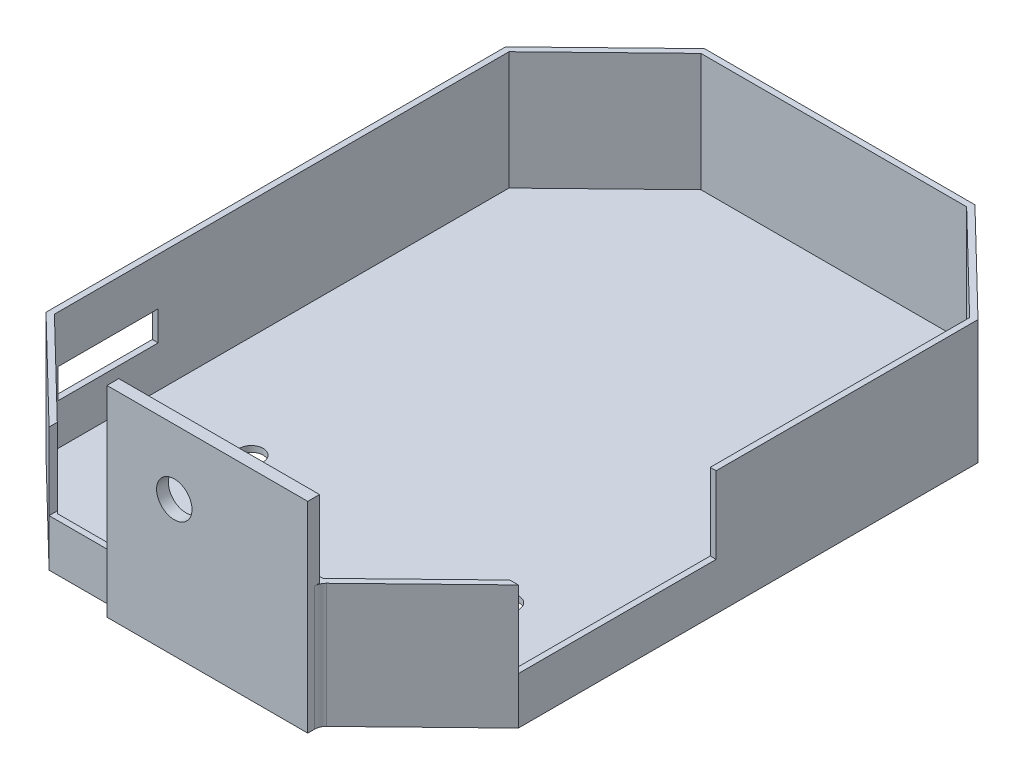
from build123d import *

# Parameters (mm, degrees)
SALIENTE_EXTRUIR1_DEPTH = 20
VACIADO1_T              = 1
CORTAR_EXTRUIR1_REACH   = 139.703
CROQUIS2_W              = 38
CROQUIS2_H              = 13
CORTAR_EXTRUIR2_REACH   = 139.477
CROQUIS3_W              = 33.5
CROQUIS3_H              = 13
CORTAR_EXTRUIR3_REACH   = 139.477
CROQUIS4_W              = 17
CROQUIS4_H              = 5
CROQUIS6_W              = 0.987179487
CROQUIS6_H              = 5.5
CORTAR_EXTRUIR5_DEPTH   = 0.35
CROQUIS7_W              = 34
CROQUIS7_H              = 34
SALIENTE_EXTRUIR2_DEPTH = 2
REDONDEO1_R             = 2
CROQUIS8_R              = 3
CORTAR_EXTRUIR6_DEPTH   = 2
CROQUIS9_R              = 2
CORTAR_EXTRUIR7_DEPTH   = 2


with BuildPart() as part:
    # Croquis1 → Saliente-Extruir1 (new body)
    with BuildSketch(Plane(origin=(0, 0, 0), x_dir=(1, 0, 0), z_dir=(0, 1, 0))):
        Polygon((0, 16), (16.5, 0), (61.5, 0), (78, 16), (78, 93), (61.5, 109), (16.5, 109), (0, 93), align=None)
    extrude(amount=SALIENTE_EXTRUIR1_DEPTH)

    # Vaciado1
    vaciado1_openings = [part.faces().sort_by_distance(p)[0] for p in [
        (39, 20, -54.5),
    ]]
    offset(amount=VACIADO1_T, openings=vaciado1_openings, kind=Kind.INTERSECTION)

    # Croquis2 → Cortar-Extruir1 (cut, up to next)
    with BuildSketch(Plane.XY.offset(1), mode=Mode.PRIVATE) as cortar_extruir1_sk1:
        with Locations((35.094769383, 13.5)):
            Rectangle(CROQUIS2_W, CROQUIS2_H)
    cortar_extruir1_tool1 = extrude(cortar_extruir1_sk1.sketch, amount=-CORTAR_EXTRUIR1_REACH, mode=Mode.PRIVATE) & part.part
    add(cortar_extruir1_tool1.solids().sort_by_distance((35.094769, 13.5, 1))[0], mode=Mode.SUBTRACT)

    # Croquis3 → Cortar-Extruir2 (cut, up to next)
    with BuildSketch(Plane(origin=(79, 0, 0), x_dir=(0, 0, -1), z_dir=(1, 0, 0)), mode=Mode.PRIVATE) as cortar_extruir2_sk1:
        with Locations((32.326746069, 13.5)):
            Rectangle(CROQUIS3_W, CROQUIS3_H)
    cortar_extruir2_tool1 = extrude(cortar_extruir2_sk1.sketch, amount=-CORTAR_EXTRUIR2_REACH, mode=Mode.PRIVATE) & part.part
    add(cortar_extruir2_tool1.solids().sort_by_distance((79, 13.5, -32.326746))[0], mode=Mode.SUBTRACT)

    # Croquis4 → Cortar-Extruir3 (cut, up to next)
    with BuildSketch(Plane.ZY.offset(1), mode=Mode.PRIVATE) as cortar_extruir3_sk1:
        with Locations((-25.076746069, 9.5)):
            Rectangle(CROQUIS4_W, CROQUIS4_H)
    cortar_extruir3_tool1 = extrude(cortar_extruir3_sk1.sketch, amount=-CORTAR_EXTRUIR3_REACH, mode=Mode.PRIVATE) & part.part
    add(cortar_extruir3_tool1.solids().sort_by_distance((-1, 9.5, -25.076746))[0], mode=Mode.SUBTRACT)

    # Croquis6 → Cortar-Extruir5 (cut)
    # profile 1 of 16: a face of its own
    with BuildSketch(Plane.XZ.offset(1)):
        with BuildLine():
            Line((74.78525641, -70), (74.78525641, -75.5))
            Line((74.78525641, -75.5), (73.903846154, -75.5))
            add(Edge.make_bspline(
                [(73.903846154, -75.5), (73.842141815, -75.500008424), (73.722745088, -75.500024723), (73.550488554, -75.493957045), (73.39109479, -75.486212134), (73.244369275, -75.47725638), (73.110366331, -75.462393242), (72.988993666, -75.446397699), (72.880700808, -75.427235506), (72.813750035, -75.410035311), (72.782251603, -75.401943109)],
                knots=[0, 0, 0, 0, 1.311970222, 2.538637508, 3.664491357, 4.705491327, 5.663608299, 6.530571107, 7.308675535, 8, 8, 8, 8], degree=3))
            add(Edge.make_bspline(
                [(72.782251603, -75.401943109), (72.740891243, -75.390529314), (72.659728939, -75.368131784), (72.543472488, -75.322907192), (72.433210644, -75.272606269), (72.328967519, -75.215334017), (72.231975971, -75.150022308), (72.140906451, -75.077916845), (72.056182581, -74.998993257), (71.979154829, -74.912783916), (71.909629264, -74.821559618), (71.848973098, -74.725277844), (71.796579646, -74.625464579), (71.756348866, -74.520397206), (71.722565206, -74.412819622), (71.699963218, -74.300546707), (71.684797783, -74.184545617), (71.683401221, -74.105585822), (71.682692308, -74.065504808)],
                knots=[0, 0, 0, 0, 1.099879008, 2.158315707, 3.195196496, 4.207130292, 5.205157476, 6.190838564, 7.183874245, 8.171129509, 9.152705923, 10.122275948, 11.08707516, 12.038677937, 13.004120747, 13.975884785, 14.972532894, 16, 16, 16, 16], degree=3))
            add(Edge.make_bspline(
                [(71.682692308, -74.065504808), (71.68441213, -74.013983414), (71.687799421, -73.912509041), (71.713793986, -73.764151677), (71.755685753, -73.623158234), (71.814882518, -73.48830796), (71.894350983, -73.359805067), (71.993450161, -73.23521183), (72.114644996, -73.116229433), (72.206065956, -73.043348232), (72.253405449, -73.005608974)],
                knots=[0, 0, 0, 0, 0.986462413, 1.942894939, 2.875435142, 3.798266677, 4.755009598, 5.761362919, 6.840791609, 8, 8, 8, 8], degree=3))
            add(Edge.make_bspline(
                [(72.253405449, -73.005608974), (72.214623713, -72.985817497), (72.138583459, -72.947011886), (72.030695506, -72.883153894), (71.930551768, -72.815508911), (71.83884727, -72.744181247), (71.753410647, -72.670586892), (71.679546635, -72.590218069), (71.609957713, -72.509278167), (71.550380915, -72.422551037), (71.498870875, -72.331889758), (71.453174551, -72.238319378), (71.415849512, -72.139979216), (71.383719327, -72.038275881), (71.359371506, -71.932158614), (71.343624489, -71.822289019), (71.331543744, -71.708731513), (71.330605338, -71.631377763), (71.330128205, -71.592047276)],
                knots=[0, 0, 0, 0, 1.164301211, 2.282872552, 3.350830854, 4.394111106, 5.389302619, 6.362088852, 7.310365691, 8.24222091, 9.170601078, 10.097577168, 11.024240953, 11.981127157, 12.948542686, 13.932080445, 14.948567018, 16, 16, 16, 16], degree=3))
            add(Edge.make_bspline(
                [(71.330128205, -71.592047276), (71.333070133, -71.51688981), (71.33887894, -71.368492109), (71.385882712, -71.151445708), (71.460907767, -70.944617018), (71.566101896, -70.751321646), (71.694277297, -70.574989966), (71.84104233, -70.419253617), (72.006541102, -70.28883387), (72.158208714, -70.199908838), (72.290088574, -70.140615463), (72.399771855, -70.104284513), (72.517497405, -70.070609821), (72.644583555, -70.044520678), (72.780396484, -70.025081432), (72.924874121, -70.010918822), (73.078514754, -70.001986756), (73.184015171, -70.000675641), (73.23838141, -70)],
                knots=[0, 0, 0, 0, 1.284225818, 2.535691644, 3.779474941, 5.035581115, 6.285533147, 7.498311102, 8.683187976, 9.876672238, 10.49522506, 11.152635743, 11.850557634, 12.588370465, 13.369094102, 14.195874568, 15.07030211, 16, 16, 16, 16], degree=3))
            Line((73.23838141, -70), (74.78525641, -70))
        make_face()
        with BuildLine():
            Line((73.798076923, -74.512820513), (73.798076923, -73.314102564))
            Line((73.798076923, -73.314102564), (73.535857372, -73.314102564))
            add(Edge.make_bspline(
                [(73.535857372, -73.314102564), (73.500218937, -73.314411924), (73.431421094, -73.315009126), (73.332057065, -73.322755057), (73.239638734, -73.335872663), (73.154288371, -73.354563169), (73.0755074, -73.37721138), (73.004228851, -73.406017738), (72.940221267, -73.44038823), (72.864804624, -73.490336845), (72.787120964, -73.566827002), (72.717559379, -73.674798385), (72.676791346, -73.799771364), (72.672228158, -73.887824113), (72.669871795, -73.933293269)],
                knots=[0, 0, 0, 0, 1.06517797, 2.056261606, 2.976983468, 3.853439442, 4.666321732, 5.424739265, 6.146762548, 6.834937974, 8.123729748, 9.372478121, 10.64318598, 12, 12, 12, 12], degree=3))
            add(Edge.make_bspline(
                [(72.669871795, -73.933293269), (72.67175662, -73.975884954), (72.675400853, -74.058234265), (72.716477367, -74.173939086), (72.780466542, -74.275944088), (72.854874673, -74.346765876), (72.925827852, -74.394381791), (72.986904113, -74.426131705), (73.054024476, -74.454323026), (73.128835512, -74.474008899), (73.209095495, -74.492486137), (73.296533117, -74.503721294), (73.390263562, -74.512014445), (73.45503998, -74.51254606), (73.488481571, -74.512820513)],
                knots=[0, 0, 0, 0, 1.347812291, 2.605940898, 3.848830773, 5.144272192, 5.83350599, 6.558918059, 7.32804622, 8.140548749, 9.012446266, 9.943019774, 10.938059685, 12, 12, 12, 12], degree=3))
            Line((73.488481571, -74.512820513), (73.798076923, -74.512820513))
        make_face(mode=Mode.SUBTRACT)
        with BuildLine():
            Line((73.798076923, -72.397435897), (73.798076923, -70.987179487))
            Line((73.798076923, -70.987179487), (73.513822115, -70.987179487))
            add(Edge.make_bspline(
                [(73.513822115, -70.987179487), (73.45762596, -70.987506323), (73.349581839, -70.988134705), (73.194786859, -70.995516786), (73.054115791, -71.009208593), (72.927535532, -71.025194438), (72.81608217, -71.050470702), (72.717720189, -71.076751508), (72.634154045, -71.110556012), (72.563957619, -71.149757128), (72.505249686, -71.194100614), (72.454412666, -71.242091663), (72.412010791, -71.295716693), (72.377910243, -71.35378946), (72.349264429, -71.415774104), (72.331716631, -71.483728115), (72.318418867, -71.555538215), (72.317683785, -71.605200203), (72.317307692, -71.630608974)],
                knots=[0, 0, 0, 0, 1.753677247, 3.371663338, 4.833688836, 6.164395063, 7.349095089, 8.3975697, 9.338276771, 10.154261968, 10.899224605, 11.628775934, 12.330426574, 13.024264642, 13.727131073, 14.452891561, 15.208446408, 16, 16, 16, 16], degree=3))
            add(Edge.make_bspline(
                [(72.317307692, -71.630608974), (72.318133035, -71.659665919), (72.319740582, -71.716261029), (72.332911219, -71.798966158), (72.356740143, -71.876232588), (72.387222394, -71.95006412), (72.428375752, -72.018447164), (72.478646545, -72.081836979), (72.537587911, -72.140420414), (72.605386013, -72.195085587), (72.68410414, -72.244189075), (72.775553023, -72.283903774), (72.877370061, -72.319731675), (72.991548522, -72.34742703), (73.11719431, -72.371181716), (73.25539653, -72.385306466), (73.40495213, -72.395832446), (73.508658725, -72.396889269), (73.562299679, -72.397435897)],
                knots=[0, 0, 0, 0, 0.844862234, 1.645564352, 2.426138401, 3.19188377, 3.963047654, 4.738710309, 5.53926994, 6.37496817, 7.267116735, 8.227971149, 9.268346748, 10.402975021, 11.641070045, 12.984514716, 14.440277492, 16, 16, 16, 16], degree=3))
            Line((73.562299679, -72.397435897), (73.798076923, -72.397435897))
        make_face(mode=Mode.SUBTRACT)
    # profile 2 of 16: a face of its own
    with BuildSketch(Plane.XZ.offset(1)):
        with Locations((69.990384616, -72.75)):
            Rectangle(CROQUIS6_W, CROQUIS6_H)
    # profile 3 of 16: a face of its own
    with BuildSketch(Plane.XZ.offset(1)):
        with BuildLine():
            add(Edge.make_bspline(
                [(65.642828526, -75.641025641), (65.547203808, -75.638550753), (65.358418956, -75.633664763), (65.080792829, -75.592905516), (64.813216637, -75.526570603), (64.555652024, -75.433977747), (64.308977411, -75.314061695), (64.072286454, -75.168460287), (63.846227779, -74.995938037), (63.633437004, -74.798956845), (63.438313072, -74.583564073), (63.26679692, -74.353924349), (63.121201447, -74.112408606), (63.00302125, -73.858969786), (62.910731039, -73.593956016), (62.846590428, -73.31726672), (62.805234083, -73.029256213), (62.800488678, -72.833143733), (62.798076923, -72.733473558)],
                knots=[0, 0, 0, 0, 1.014151002, 2.002163778, 2.969868608, 3.93493411, 4.9003771, 5.874719092, 6.87846472, 7.912488755, 8.947011879, 9.957751389, 10.948740761, 11.933621513, 12.919426746, 13.920294397, 14.943031967, 16, 16, 16, 16], degree=3))
            add(Edge.make_bspline(
                [(62.798076923, -72.733473558), (62.800646149, -72.634926624), (62.805708892, -72.44073673), (62.84489708, -72.155377652), (62.910152474, -71.881662207), (63.00066344, -71.619496819), (63.116777232, -71.368877191), (63.260149181, -71.130616554), (63.429837327, -70.904225356), (63.622375423, -70.691090557), (63.833035456, -70.496369172), (64.057489913, -70.325427715), (64.293653496, -70.18165017), (64.540017318, -70.062311722), (64.798905543, -69.972632275), (65.067447897, -69.905506942), (65.347890814, -69.866691379), (65.538411519, -69.861572569), (65.635116186, -69.858974359)],
                knots=[0, 0, 0, 0, 1.051517626, 2.07204922, 3.067438659, 4.05042616, 5.027204762, 6.009981242, 7.012629434, 8.042243656, 9.071350414, 10.070091277, 11.048190212, 12.017682766, 12.985867053, 13.966945899, 14.968060614, 16, 16, 16, 16], degree=3))
            add(Edge.make_bspline(
                [(65.635116186, -69.858974359), (65.7362655, -69.861277758), (65.935010077, -69.865803622), (66.225945855, -69.908479456), (66.504290203, -69.973544448), (66.769280451, -70.067742901), (67.020710598, -70.190140676), (67.259708202, -70.337926649), (67.484475789, -70.513955508), (67.694264141, -70.712917925), (67.884310757, -70.930682907), (68.05206996, -71.160717647), (68.193577116, -71.40128253), (68.308839495, -71.652485548), (68.399707629, -71.912766737), (68.463804796, -72.183710965), (68.501668517, -72.464668495), (68.506942714, -72.655500462), (68.509615385, -72.752203526)],
                knots=[0, 0, 0, 0, 1.067953136, 2.098381936, 3.099641766, 4.083805132, 5.062469929, 6.048665414, 7.046702845, 8.073106546, 9.098695993, 10.09591865, 11.076726721, 12.041940862, 13.011263376, 13.984305721, 14.978557872, 16, 16, 16, 16], degree=3))
            add(Edge.make_bspline(
                [(68.509615385, -72.752203526), (68.508764974, -72.817257463), (68.507074919, -72.946541607), (68.487163443, -73.138183839), (68.457632288, -73.325810789), (68.417204846, -73.509775282), (68.362735639, -73.68960323), (68.296532742, -73.86574824), (68.2193855, -74.038209337), (68.130421315, -74.205426855), (68.029785073, -74.365400126), (67.922332719, -74.519526367), (67.803948601, -74.663759459), (67.67707622, -74.799666128), (67.541218627, -74.926625114), (67.396139211, -75.045069926), (67.242066324, -75.154698465), (67.080666471, -75.25641664), (66.912491763, -75.345505958), (66.741543391, -75.426258902), (66.566180273, -75.491733366), (66.387675663, -75.54596138), (66.206439958, -75.589481563), (66.021073861, -75.618418774), (65.83314182, -75.638487554), (65.706416841, -75.640177604), (65.642828526, -75.641025641)],
                knots=[0, 0, 0, 0, 1.034641744, 2.056182551, 3.061960284, 4.05571729, 5.050247014, 6.048716841, 7.047801973, 8.054190544, 9.059424999, 10.053182006, 11.041513076, 12.025412457, 13.009311837, 13.997642908, 15.002928308, 16.016213968, 17.030509951, 18.02913364, 19.022134519, 20.005478534, 20.996155877, 21.984625117, 22.988721131, 24, 24, 24, 24], degree=3))
        make_face()
        with BuildLine():
            add(Edge.make_bspline(
                [(65.658253205, -74.653846154), (65.722608303, -74.65211936), (65.849619515, -74.648711359), (66.035921884, -74.622747069), (66.214778533, -74.581278984), (66.38519895, -74.521213547), (66.5479182, -74.44476343), (66.703238017, -74.35220501), (66.848957182, -74.240321312), (66.987212981, -74.115252807), (67.111683162, -73.975322087), (67.223598714, -73.826996311), (67.31408698, -73.666706509), (67.391893971, -73.499732195), (67.449366468, -73.321850764), (67.493125782, -73.13594922), (67.516959995, -72.940119148), (67.520584592, -72.806983153), (67.522435897, -72.738982372)],
                knots=[0, 0, 0, 0, 1.033668485, 2.040047952, 3.016132939, 3.979056467, 4.937231767, 5.900589077, 6.877725736, 7.88429546, 8.891280164, 9.882584218, 10.863295226, 11.842887319, 12.837417301, 13.860812229, 14.907384602, 16, 16, 16, 16], degree=3))
            add(Edge.make_bspline(
                [(67.522435897, -72.738982372), (67.520185545, -72.663601224), (67.515775227, -72.515866665), (67.485195138, -72.300239941), (67.431612863, -72.096836189), (67.358413018, -71.904974956), (67.261109544, -71.726673771), (67.144732393, -71.559771033), (67.006367735, -71.405302285), (66.899960047, -71.315041856), (66.845953526, -71.269230769)],
                knots=[0, 0, 0, 0, 1.078343132, 2.113373867, 3.107373148, 4.082093053, 5.043582658, 6.005574554, 6.987742499, 8, 8, 8, 8], degree=3))
            add(Edge.make_bspline(
                [(66.845953526, -71.269230769), (66.801700088, -71.235392664), (66.71419025, -71.168478833), (66.574505496, -71.082715031), (66.430657705, -71.009206897), (66.281561365, -70.949813195), (66.127531359, -70.903095107), (65.96858881, -70.870379198), (65.804958925, -70.849847136), (65.694304729, -70.847393165), (65.638421474, -70.846153846)],
                knots=[0, 0, 0, 0, 1.023928204, 2.024787132, 3.009472467, 3.9914905, 4.972207045, 5.96565515, 6.972602802, 8, 8, 8, 8], degree=3))
            add(Edge.make_bspline(
                [(65.638421474, -70.846153846), (65.575174188, -70.847897752), (65.450733163, -70.851328942), (65.267881431, -70.876938315), (65.092785175, -70.920468287), (64.923821436, -70.979580412), (64.763252766, -71.058800898), (64.608575217, -71.15286915), (64.461632279, -71.264718954), (64.32421528, -71.392939291), (64.198279946, -71.53287661), (64.086862223, -71.682004666), (63.99458998, -71.84032926), (63.917623185, -72.00573552), (63.857657481, -72.179540425), (63.816619654, -72.361757084), (63.790245429, -72.551650336), (63.786940212, -72.680866915), (63.78525641, -72.746694712)],
                knots=[0, 0, 0, 0, 1.026350473, 2.019376834, 2.989435443, 3.95094063, 4.91865229, 5.889827372, 6.885283771, 7.910196595, 8.935871797, 9.9372888, 10.925850568, 11.904605667, 12.894245083, 13.903507864, 14.931967858, 16, 16, 16, 16], degree=3))
            add(Edge.make_bspline(
                [(63.78525641, -72.746694712), (63.786991949, -72.812146681), (63.790408093, -72.940978902), (63.81616098, -73.130345367), (63.858974279, -73.311560806), (63.919483154, -73.485092345), (63.994864622, -73.651851013), (64.089556294, -73.810389487), (64.201505682, -73.960570603), (64.328666257, -74.101501515), (64.467049961, -74.231016678), (64.615624696, -74.343410084), (64.770226066, -74.441076955), (64.934403241, -74.5175851), (65.104796811, -74.578539013), (65.282446655, -74.62342634), (65.468025598, -74.648528965), (65.594278792, -74.652057959), (65.658253205, -74.653846154)],
                knots=[0, 0, 0, 0, 1.055040155, 2.076685641, 3.074845078, 4.052329834, 5.035358467, 6.020382375, 7.023447318, 8.050688466, 9.077178457, 10.074336316, 11.0503314, 12.019748348, 12.988025369, 13.964577102, 14.968620271, 16, 16, 16, 16], degree=3))
        make_face(mode=Mode.SUBTRACT)
    # profile 4 of 16: a face of its own
    with BuildSketch(Plane.XZ.offset(1)):
        with BuildLine():
            Line((56.875, -74.545873397), (57.598858173, -73.853966346))
            add(Edge.make_bspline(
                [(57.598858173, -73.853966346), (57.660190249, -73.917550259), (57.780186026, -74.041951742), (57.974463806, -74.204806827), (58.174189337, -74.34321321), (58.379921646, -74.456024252), (58.59154255, -74.545552001), (58.809420229, -74.60800652), (59.033028395, -74.647331583), (59.184132782, -74.651662563), (59.260316506, -74.653846154)],
                knots=[0, 0, 0, 0, 1.115370381, 2.182214363, 3.196266025, 4.180416361, 5.141116029, 6.092551847, 7.038303877, 8, 8, 8, 8], degree=3))
            add(Edge.make_bspline(
                [(59.260316506, -74.653846154), (59.323930719, -74.652087218), (59.449466358, -74.648616151), (59.633768156, -74.623108488), (59.810129193, -74.579895211), (59.97868939, -74.519829069), (60.140282127, -74.444185656), (60.293402689, -74.34910734), (60.438873961, -74.237767473), (60.574996232, -74.110360889), (60.697885198, -73.970129804), (60.808609902, -73.822441333), (60.900322405, -73.664683226), (60.975187218, -73.499156078), (61.034182412, -73.325800118), (61.076053668, -73.144624022), (61.100313902, -72.955218728), (61.103930944, -72.826457747), (61.105769231, -72.761017628)],
                knots=[0, 0, 0, 0, 1.035268443, 2.04298821, 3.02163646, 3.985902049, 4.951223231, 5.920091634, 6.913651787, 7.92868536, 8.949353712, 9.945284791, 10.92850487, 11.913014323, 12.897904816, 13.904240668, 14.934873455, 16, 16, 16, 16], degree=3))
            add(Edge.make_bspline(
                [(61.105769231, -72.761017628), (61.105231895, -72.715088522), (61.104172794, -72.62456131), (61.092871566, -72.4909905), (61.074102959, -72.361114995), (61.047778504, -72.235319599), (61.014638256, -72.11306166), (60.974077747, -71.995137506), (60.925036195, -71.881395841), (60.870150552, -71.771240853), (60.80888645, -71.665605934), (60.740212202, -71.565891913), (60.664897353, -71.472873608), (60.585955519, -71.383314308), (60.498158557, -71.302455157), (60.405437446, -71.225839892), (60.306461816, -71.155366547), (60.201351863, -71.092015855), (60.093245, -71.032974109), (59.979925949, -70.984079939), (59.864561289, -70.940126991), (59.745127137, -70.907061149), (59.623727317, -70.878300857), (59.498672058, -70.860736052), (59.371148182, -70.847389123), (59.284959651, -70.846567378), (59.241586538, -70.846153846)],
                knots=[0, 0, 0, 0, 1.103833241, 2.175677997, 3.219414644, 4.256521947, 5.263082927, 6.262573145, 7.25136242, 8.238376666, 9.219530388, 10.184343756, 11.145312504, 12.095474572, 13.051075647, 14.010745898, 14.985684176, 15.968306307, 16.959653902, 17.943861036, 18.93268972, 19.924626761, 20.920484516, 21.929288403, 22.957944781, 24, 24, 24, 24], degree=3))
            add(Edge.make_bspline(
                [(59.241586538, -70.846153846), (59.168017001, -70.848277005), (59.023471992, -70.852448461), (58.811362666, -70.885211063), (58.608661717, -70.938861149), (58.447022263, -71.003391684), (58.320547072, -71.066124583), (58.224312824, -71.123320088), (58.125219448, -71.188106476), (58.023945404, -71.262278434), (57.919942488, -71.344953278), (57.814997382, -71.437859017), (57.706437892, -71.537960227), (57.63532108, -71.609403411), (57.598858173, -71.646033654)],
                knots=[0, 0, 0, 0, 1.404640003, 2.759752344, 4.088613405, 5.401587939, 6.076032573, 6.783413463, 7.538272532, 8.336594406, 9.180107851, 10.074881764, 11.012956238, 12, 12, 12, 12], degree=3))
            Line((57.598858173, -71.646033654), (56.897035256, -70.908954327))
            add(Edge.make_bspline(
                [(56.897035256, -70.908954327), (56.946369629, -70.861323536), (57.042659774, -70.768358419), (57.187910796, -70.636356659), (57.332978974, -70.517738287), (57.474359938, -70.408198518), (57.614369051, -70.310926646), (57.752993549, -70.225832031), (57.888656894, -70.150739725), (58.024201671, -70.086995215), (58.160703847, -70.032524065), (58.301091047, -69.986585788), (58.44543035, -69.946484822), (58.59491718, -69.914927429), (58.74888454, -69.889237527), (58.907827184, -69.872262205), (59.071002478, -69.860490887), (59.181335077, -69.859483994), (59.237179487, -69.858974359)],
                knots=[0, 0, 0, 0, 1.244537013, 2.429070097, 3.56066612, 4.644477994, 5.67429546, 6.652817684, 7.595405349, 8.486886006, 9.369351459, 10.26090686, 11.166404474, 12.086719576, 13.0323422, 13.998023148, 14.9867073, 16, 16, 16, 16], degree=3))
            add(Edge.make_bspline(
                [(59.237179487, -69.858974359), (59.339754798, -69.861593829), (59.540466168, -69.866719405), (59.834631806, -69.904565713), (60.114313104, -69.968433286), (60.380012609, -70.057532544), (60.630917169, -70.173227456), (60.867813624, -70.313609938), (61.090307469, -70.480012372), (61.296484167, -70.669955514), (61.482922366, -70.879775901), (61.647898431, -71.104979105), (61.783766421, -71.347182368), (61.899043428, -71.601197539), (61.985426034, -71.870995856), (62.048304957, -72.154139381), (62.086566454, -72.451843179), (62.090793101, -72.655134308), (62.092948718, -72.758814103)],
                knots=[0, 0, 0, 0, 1.07798487, 2.109316747, 3.111276023, 4.08905949, 5.049398091, 6.009992678, 6.978127636, 7.964347882, 8.951383687, 9.924270623, 10.892397886, 11.86520058, 12.851549246, 13.863953586, 14.910602472, 16, 16, 16, 16], degree=3))
            add(Edge.make_bspline(
                [(62.092948718, -72.758814103), (62.09200726, -72.826430303), (62.09014152, -72.960429088), (62.071748432, -73.158332035), (62.043532632, -73.350451314), (62.003374924, -73.536550632), (61.953444143, -73.717274348), (61.88988948, -73.891804204), (61.816276861, -74.061095636), (61.730334922, -74.223570991), (61.633998597, -74.379435587), (61.528676941, -74.52829545), (61.412341802, -74.668669939), (61.286098689, -74.801173012), (61.150996803, -74.926661076), (61.005714856, -75.044243532), (60.850113932, -75.15316212), (60.685781211, -75.253506355), (60.515845229, -75.345658681), (60.340185212, -75.422928179), (60.162224437, -75.491138407), (59.980757118, -75.546233298), (59.795383844, -75.587791511), (59.607520165, -75.619152675), (59.415631108, -75.636704825), (59.28679195, -75.639576194), (59.221754808, -75.641025641)],
                knots=[0, 0, 0, 0, 1.07193642, 2.124315995, 3.14887099, 4.149444713, 5.141371803, 6.119544533, 7.092241254, 8.06650569, 9.031360777, 9.996057679, 10.955696533, 11.919602115, 12.89624813, 13.877605408, 14.880920851, 15.905674436, 16.929600311, 17.943674756, 18.946313929, 19.950355855, 20.947755382, 21.956851243, 22.968632213, 24, 24, 24, 24], degree=3))
            add(Edge.make_bspline(
                [(59.221754808, -75.641025641), (59.166271877, -75.640193738), (59.055882883, -75.638538581), (58.891490617, -75.624765431), (58.728431079, -75.603073424), (58.567202202, -75.570573508), (58.407078948, -75.531214614), (58.248731712, -75.482735081), (58.09259714, -75.423601413), (57.937321669, -75.358187098), (57.786002037, -75.283716296), (57.639953314, -75.200360826), (57.498813618, -75.110301346), (57.363433786, -75.011988819), (57.232860281, -74.906867329), (57.107232421, -74.794940354), (56.987755701, -74.674177569), (56.912775242, -74.588857665), (56.875, -74.545873397)],
                knots=[0, 0, 0, 0, 0.996333415, 1.982307736, 2.96084097, 3.949129141, 4.93457382, 5.921430247, 6.92116383, 7.931890485, 8.946633814, 9.948019707, 10.950686436, 11.952094051, 12.951305284, 13.960287133, 14.972390273, 16, 16, 16, 16], degree=3))
        make_face()
    # profile 5 of 16: a face of its own
    with BuildSketch(Plane.XZ.offset(1)):
        with BuildLine():
            Line((55.887820513, -75.5), (54.737580128, -75.5))
            add(Edge.make_bspline(
                [(54.737580128, -75.5), (54.661548913, -75.499734911), (54.515319468, -75.499225069), (54.304475424, -75.490973), (54.11074789, -75.479789791), (53.933706464, -75.461675069), (53.773552917, -75.440859747), (53.630613844, -75.412916574), (53.504357634, -75.381918293), (53.393231184, -75.343773294), (53.293188999, -75.299915037), (53.200301966, -75.250264989), (53.112249296, -75.193471994), (53.029672159, -75.129718385), (52.950029414, -75.061425402), (52.877585061, -74.984623887), (52.809107322, -74.901827555), (52.745315437, -74.813031046), (52.688039457, -74.718441636), (52.638650421, -74.619190123), (52.596124976, -74.515878559), (52.562470363, -74.408129451), (52.535630614, -74.296249542), (52.517682634, -74.180516418), (52.504347331, -74.060671331), (52.503590961, -73.979239551), (52.503205128, -73.937700321)],
                knots=[0, 0, 0, 0, 1.748592178, 3.36303531, 4.852592433, 6.210838904, 7.455605234, 8.565530618, 9.559147328, 10.443333557, 11.264119507, 12.069061813, 12.863340979, 13.67089394, 14.467102114, 15.273638367, 16.095597024, 16.937114566, 17.786018611, 18.63597263, 19.484582448, 20.352808207, 21.22970172, 22.128176732, 23.04516274, 24, 24, 24, 24], degree=3))
            add(Edge.make_bspline(
                [(52.503205128, -73.937700321), (52.504220674, -73.894345166), (52.506211975, -73.809333611), (52.516849279, -73.684442158), (52.536625278, -73.564665042), (52.565602813, -73.450770922), (52.600287219, -73.341593323), (52.645206869, -73.238836228), (52.696287425, -73.140681875), (52.756885532, -73.048747759), (52.823430877, -72.961058185), (52.900715407, -72.880798007), (52.98437224, -72.804162568), (53.076947104, -72.733761573), (53.178162841, -72.67003328), (53.28611619, -72.610389139), (53.402299064, -72.555888529), (53.483908313, -72.52540443), (53.525641026, -72.509815705)],
                knots=[0, 0, 0, 0, 1.099808295, 2.156523617, 3.176426857, 4.17500812, 5.135317955, 6.078349783, 7.015890908, 7.9382699, 8.868004242, 9.803692517, 10.759882289, 11.743580734, 12.748787378, 13.791075452, 14.870417076, 16, 16, 16, 16], degree=3))
            Line((53.525641026, -72.509815705), (52.256410256, -70))
            Line((52.256410256, -70), (53.353766026, -70))
            Line((53.353766026, -70), (54.565705128, -72.397435897))
            Line((54.565705128, -72.397435897), (54.900641026, -72.397435897))
            Line((54.900641026, -72.397435897), (54.900641026, -70))
            Line((54.900641026, -70), (55.887820513, -70))
            Line((55.887820513, -70), (55.887820513, -75.5))
        make_face()
        with BuildLine():
            Line((54.900641026, -73.384615385), (54.516125801, -73.384615385))
            add(Edge.make_bspline(
                [(54.516125801, -73.384615385), (54.469115611, -73.385144837), (54.379101199, -73.386158625), (54.24964877, -73.390861163), (54.132074675, -73.402191378), (54.025875819, -73.416508179), (53.930512005, -73.433034306), (53.846852379, -73.456733173), (53.773549025, -73.482080848), (53.711654435, -73.513732418), (53.658557319, -73.549094151), (53.61405109, -73.591038394), (53.574842702, -73.636986088), (53.544087304, -73.689829202), (53.519238924, -73.747402766), (53.503828761, -73.810789969), (53.491602257, -73.878843112), (53.490801377, -73.926251273), (53.490384615, -73.950921474)],
                knots=[0, 0, 0, 0, 1.688935225, 3.233948049, 4.651771667, 5.929878493, 7.083962697, 8.124219224, 9.050753627, 9.864999381, 10.615157594, 11.334035464, 12.05533055, 12.777108108, 13.522027315, 14.29964284, 15.115170198, 16, 16, 16, 16], degree=3))
            add(Edge.make_bspline(
                [(53.490384615, -73.950921474), (53.491449552, -73.980086437), (53.493528408, -74.037019201), (53.516006706, -74.119212308), (53.54992364, -74.195840998), (53.597939811, -74.265843836), (53.657842095, -74.327092146), (53.726488197, -74.380759031), (53.805194407, -74.423712859), (53.877868388, -74.45300878), (53.945076403, -74.469894817), (54.005325692, -74.481973387), (54.075226036, -74.491758335), (54.154678022, -74.498959625), (54.243535645, -74.505811794), (54.342009773, -74.510054023), (54.45001241, -74.511947001), (54.525306575, -74.512520959), (54.564603365, -74.512820513)],
                knots=[0, 0, 0, 0, 1.020050218, 1.991234449, 2.965145773, 3.94719294, 4.948794399, 5.958308566, 6.989992871, 8.082620171, 8.694688219, 9.416833949, 10.236190632, 11.167557654, 12.21328564, 13.36031274, 14.622320386, 16, 16, 16, 16], degree=3))
            Line((54.564603365, -74.512820513), (54.900641026, -74.512820513))
            Line((54.900641026, -74.512820513), (54.900641026, -73.384615385))
        make_face(mode=Mode.SUBTRACT)
    # profile 6 of 16: a face of its own
    with BuildSketch(Plane.XZ.offset(1)):
        with BuildLine():
            Line((51.445512821, -75.5), (50.458333333, -75.5))
            Line((50.458333333, -75.5), (50.458333333, -71.921474359))
            add(Edge.make_bspline(
                [(50.458333333, -71.921474359), (50.458277473, -71.884374013), (50.458169578, -71.812715079), (50.45300842, -71.709903855), (50.448144093, -71.615048366), (50.439867596, -71.528917492), (50.426885326, -71.451243866), (50.414764551, -71.381741317), (50.398146743, -71.321029237), (50.3732615, -71.251875706), (50.334410013, -71.174189127), (50.272788121, -71.092304284), (50.199201145, -71.019419861), (50.112541235, -70.9582227), (50.015788456, -70.906461436), (49.907036084, -70.872225695), (49.789819499, -70.849004207), (49.708154618, -70.847121736), (49.666165865, -70.846153846)],
                knots=[0, 0, 0, 0, 1.155195489, 2.231248153, 3.20507519, 4.113220553, 4.92363642, 5.657123012, 6.309133385, 6.880755525, 7.944644177, 8.999147208, 10.058600405, 11.156792429, 12.29246015, 13.460660758, 14.694375292, 16, 16, 16, 16], degree=3))
            add(Edge.make_bspline(
                [(49.666165865, -70.846153846), (49.621601111, -70.847440104), (49.534707386, -70.849948088), (49.40947066, -70.875097377), (49.293115172, -70.91421029), (49.188819968, -70.971173314), (49.09620878, -71.038416201), (49.019374173, -71.116930495), (48.956095618, -71.202703654), (48.916317568, -71.283460554), (48.893245632, -71.357083714), (48.878131692, -71.423430689), (48.865247034, -71.500704548), (48.85392196, -71.589237786), (48.847329855, -71.689333431), (48.839912416, -71.800550857), (48.837239629, -71.922931528), (48.83677878, -72.008146931), (48.836538462, -72.052584135)],
                knots=[0, 0, 0, 0, 1.260834212, 2.45841325, 3.603280198, 4.724942815, 5.811019112, 6.833506895, 7.823953325, 8.819576102, 9.365694356, 10.006623749, 10.745436914, 11.584131356, 12.533575865, 13.586103333, 14.74122738, 16, 16, 16, 16], degree=3))
            Line((48.836538462, -72.052584135), (48.836538462, -75.5))
            Line((48.836538462, -75.5), (47.849358974, -75.5))
            Line((47.849358974, -75.5), (47.849358974, -72.218950321))
            add(Edge.make_bspline(
                [(47.849358974, -72.218950321), (47.849478319, -72.152475182), (47.849707808, -72.024649975), (47.853989835, -71.840975741), (47.86183402, -71.673127805), (47.871571134, -71.521410401), (47.883247891, -71.385390122), (47.898359645, -71.265136355), (47.9168456, -71.160713587), (47.944550892, -71.04185483), (47.992298572, -70.904989769), (48.069297794, -70.747394676), (48.167043532, -70.593109254), (48.282548985, -70.443780729), (48.413066061, -70.305210802), (48.555091098, -70.183153846), (48.707854234, -70.08200534), (48.870302024, -69.999328419), (49.045450973, -69.936248002), (49.233221598, -69.891866379), (49.434289402, -69.863270665), (49.572781468, -69.860435167), (49.644130609, -69.858974359)],
                knots=[0, 0, 0, 0, 1.170912322, 2.251550202, 3.235884933, 4.130507595, 4.929373885, 5.640290569, 6.26461063, 6.796528574, 7.788739464, 8.810047518, 9.879767716, 11.000329969, 12.130634485, 13.227340211, 14.291294104, 15.350161901, 16.430664233, 17.561930962, 18.743941553, 20, 20, 20, 20], degree=3))
            add(Edge.make_bspline(
                [(49.644130609, -69.858974359), (49.691540681, -69.85977531), (49.785079779, -69.86135557), (49.922658051, -69.875213854), (50.055606179, -69.89581), (50.184007608, -69.925252353), (50.307372503, -69.965524721), (50.426364619, -70.01270681), (50.541109258, -70.067711261), (50.6490223, -70.133266299), (50.752354357, -70.203058071), (50.848454991, -70.27813647), (50.936896338, -70.357570288), (51.01760388, -70.441483367), (51.090573532, -70.529847491), (51.155825326, -70.622650899), (51.213217305, -70.719940995), (51.264206356, -70.823456471), (51.307843182, -70.938463424), (51.344649194, -71.069048202), (51.376645446, -71.216917683), (51.400866742, -71.38304595), (51.422214796, -71.566676613), (51.43604746, -71.768510444), (51.443187511, -71.987894368), (51.444718132, -72.139985549), (51.445512821, -72.218950321)],
                knots=[0, 0, 0, 0, 1.001274302, 1.975493657, 2.918061388, 3.842055805, 4.754744607, 5.656586832, 6.54484551, 7.438946169, 8.321187755, 9.177850665, 10.012845812, 10.830395126, 11.634995211, 12.431362049, 13.224358528, 14.018909421, 14.866105371, 15.818803578, 16.882454076, 18.059767828, 19.363726729, 20.787034531, 22.331848803, 24, 24, 24, 24], degree=3))
            Line((51.445512821, -72.218950321), (51.445512821, -75.5))
        make_face()
    # profile 7 of 16: a face of its own
    with BuildSketch(Plane.XZ.offset(1)):
        with BuildLine():
            Line((41.644230769, -74.545873397), (42.368088942, -73.853966346))
            add(Edge.make_bspline(
                [(42.368088942, -73.853966346), (42.429421018, -73.917550259), (42.549416795, -74.041951742), (42.743694575, -74.204806827), (42.943420106, -74.34321321), (43.149152416, -74.456024252), (43.360773319, -74.545552001), (43.578650998, -74.60800652), (43.802259164, -74.647331583), (43.953363552, -74.651662563), (44.029547276, -74.653846154)],
                knots=[0, 0, 0, 0, 1.115370381, 2.182214363, 3.196266025, 4.180416361, 5.141116029, 6.092551847, 7.038303877, 8, 8, 8, 8], degree=3))
            add(Edge.make_bspline(
                [(44.029547276, -74.653846154), (44.093161488, -74.652087218), (44.218697127, -74.648616151), (44.402998925, -74.623108488), (44.579359962, -74.579895211), (44.747920159, -74.519829069), (44.909512896, -74.444185656), (45.062633458, -74.34910734), (45.20810473, -74.237767473), (45.344227001, -74.110360889), (45.467115967, -73.970129804), (45.577840671, -73.822441333), (45.669553174, -73.664683226), (45.744417987, -73.499156078), (45.803413181, -73.325800118), (45.845284437, -73.144624022), (45.869544671, -72.955218728), (45.873161713, -72.826457747), (45.875, -72.761017628)],
                knots=[0, 0, 0, 0, 1.035268443, 2.04298821, 3.02163646, 3.985902049, 4.951223231, 5.920091634, 6.913651787, 7.92868536, 8.949353712, 9.945284791, 10.92850487, 11.913014323, 12.897904816, 13.904240668, 14.934873455, 16, 16, 16, 16], degree=3))
            add(Edge.make_bspline(
                [(45.875, -72.761017628), (45.874462664, -72.715088522), (45.873403563, -72.62456131), (45.862102335, -72.4909905), (45.843333729, -72.361114995), (45.817009274, -72.235319599), (45.783869025, -72.11306166), (45.743308516, -71.995137506), (45.694266964, -71.881395841), (45.639381321, -71.771240853), (45.578117219, -71.665605934), (45.509442971, -71.565891913), (45.434128122, -71.472873608), (45.355186288, -71.383314308), (45.267389326, -71.302455157), (45.174668215, -71.225839892), (45.075692585, -71.155366547), (44.970582632, -71.092015855), (44.862475769, -71.032974109), (44.749156718, -70.984079939), (44.633792059, -70.940126991), (44.514357906, -70.907061149), (44.392958087, -70.878300857), (44.267902828, -70.860736052), (44.140378951, -70.847389123), (44.054190421, -70.846567378), (44.010817308, -70.846153846)],
                knots=[0, 0, 0, 0, 1.103833241, 2.175677997, 3.219414644, 4.256521947, 5.263082927, 6.262573145, 7.25136242, 8.238376666, 9.219530388, 10.184343756, 11.145312504, 12.095474572, 13.051075647, 14.010745898, 14.985684176, 15.968306307, 16.959653902, 17.943861036, 18.93268972, 19.924626761, 20.920484516, 21.929288403, 22.957944781, 24, 24, 24, 24], degree=3))
            add(Edge.make_bspline(
                [(44.010817308, -70.846153846), (43.93724777, -70.848277005), (43.792702761, -70.852448461), (43.580593435, -70.885211063), (43.377892486, -70.938861149), (43.216253032, -71.003391684), (43.089777841, -71.066124583), (42.993543593, -71.123320088), (42.894450217, -71.188106476), (42.793176174, -71.262278434), (42.689173257, -71.344953278), (42.584228151, -71.437859017), (42.475668661, -71.537960227), (42.404551849, -71.609403411), (42.368088942, -71.646033654)],
                knots=[0, 0, 0, 0, 1.404640003, 2.759752344, 4.088613405, 5.401587939, 6.076032573, 6.783413463, 7.538272532, 8.336594406, 9.180107851, 10.074881764, 11.012956238, 12, 12, 12, 12], degree=3))
            Line((42.368088942, -71.646033654), (41.666266026, -70.908954327))
            add(Edge.make_bspline(
                [(41.666266026, -70.908954327), (41.715600398, -70.861323536), (41.811890544, -70.768358419), (41.957141565, -70.636356659), (42.102209744, -70.517738287), (42.243590707, -70.408198518), (42.38359982, -70.310926646), (42.522224319, -70.225832031), (42.657887663, -70.150739725), (42.79343244, -70.086995215), (42.929934616, -70.032524065), (43.070321816, -69.986585788), (43.214661119, -69.946484822), (43.364147949, -69.914927429), (43.51811531, -69.889237527), (43.677057953, -69.872262205), (43.840233248, -69.860490887), (43.950565846, -69.859483994), (44.006410256, -69.858974359)],
                knots=[0, 0, 0, 0, 1.244537013, 2.429070097, 3.56066612, 4.644477994, 5.67429546, 6.652817684, 7.595405349, 8.486886006, 9.369351459, 10.26090686, 11.166404474, 12.086719576, 13.0323422, 13.998023148, 14.9867073, 16, 16, 16, 16], degree=3))
            add(Edge.make_bspline(
                [(44.006410256, -69.858974359), (44.108985567, -69.861593829), (44.309696937, -69.866719405), (44.603862575, -69.904565713), (44.883543874, -69.968433286), (45.149243378, -70.057532544), (45.400147938, -70.173227456), (45.637044393, -70.313609938), (45.859538238, -70.480012372), (46.065714936, -70.669955514), (46.252153135, -70.879775901), (46.4171292, -71.104979105), (46.552997191, -71.347182368), (46.668274197, -71.601197539), (46.754656803, -71.870995856), (46.817535726, -72.154139381), (46.855797223, -72.451843179), (46.86002387, -72.655134308), (46.862179487, -72.758814103)],
                knots=[0, 0, 0, 0, 1.07798487, 2.109316747, 3.111276023, 4.08905949, 5.049398091, 6.009992678, 6.978127636, 7.964347882, 8.951383687, 9.924270623, 10.892397886, 11.86520058, 12.851549246, 13.863953586, 14.910602472, 16, 16, 16, 16], degree=3))
            add(Edge.make_bspline(
                [(46.862179487, -72.758814103), (46.861238029, -72.826430303), (46.859372289, -72.960429088), (46.840979201, -73.158332035), (46.812763401, -73.350451314), (46.772605693, -73.536550632), (46.722674912, -73.717274348), (46.65912025, -73.891804204), (46.58550763, -74.061095636), (46.499565692, -74.223570991), (46.403229366, -74.379435587), (46.29790771, -74.52829545), (46.181572571, -74.668669939), (46.055329458, -74.801173012), (45.920227573, -74.926661076), (45.774945626, -75.044243532), (45.619344701, -75.15316212), (45.455011981, -75.253506355), (45.285075998, -75.345658681), (45.109415982, -75.422928179), (44.931455206, -75.491138407), (44.749987887, -75.546233298), (44.564614613, -75.587791511), (44.376750934, -75.619152675), (44.184861878, -75.636704825), (44.05602272, -75.639576194), (43.990985577, -75.641025641)],
                knots=[0, 0, 0, 0, 1.07193642, 2.124315995, 3.14887099, 4.149444713, 5.141371803, 6.119544533, 7.092241254, 8.06650569, 9.031360777, 9.996057679, 10.955696533, 11.919602115, 12.89624813, 13.877605408, 14.880920851, 15.905674436, 16.929600311, 17.943674756, 18.946313929, 19.950355855, 20.947755382, 21.956851243, 22.968632213, 24, 24, 24, 24], degree=3))
            add(Edge.make_bspline(
                [(43.990985577, -75.641025641), (43.935502646, -75.640193738), (43.825113653, -75.638538581), (43.660721386, -75.624765431), (43.497661848, -75.603073424), (43.336432971, -75.570573508), (43.176309718, -75.531214614), (43.017962481, -75.482735081), (42.861827909, -75.423601413), (42.706552438, -75.358187098), (42.555232806, -75.283716296), (42.409184084, -75.200360826), (42.268044388, -75.110301346), (42.132664556, -75.011988819), (42.00209105, -74.906867329), (41.87646319, -74.794940354), (41.75698647, -74.674177569), (41.682006012, -74.588857665), (41.644230769, -74.545873397)],
                knots=[0, 0, 0, 0, 0.996333415, 1.982307736, 2.96084097, 3.949129141, 4.93457382, 5.921430247, 6.92116383, 7.931890485, 8.946633814, 9.948019707, 10.950686436, 11.952094051, 12.951305284, 13.960287133, 14.972390273, 16, 16, 16, 16], degree=3))
        make_face()
    # profile 8 of 16: a face of its own
    with BuildSketch(Plane.XZ.offset(1)):
        Polygon((40.657051282, -75.5), (37.695512821, -75.5), (37.695512821, -74.512820513), (39.669871795, -74.512820513), (39.669871795, -73.455128205), (37.695512821, -73.455128205), (37.695512821, -72.467948718), (39.669871795, -72.467948718), (39.669871795, -70.987179487), (37.695512821, -70.987179487), (37.695512821, -70), (40.657051282, -70), align=None)
    # profile 9 of 16: a face of its own
    with BuildSketch(Plane.XZ.offset(1)):
        with BuildLine():
            Line((33.887820513, -74.765124199), (34.626001603, -74.08974359))
            add(Edge.make_bspline(
                [(34.626001603, -74.08974359), (34.657616031, -74.134355579), (34.718311324, -74.220004376), (34.816790955, -74.334564937), (34.91468224, -74.432934737), (35.013986666, -74.512301271), (35.112994523, -74.576193831), (35.213809285, -74.620263106), (35.315271149, -74.648604321), (35.383473659, -74.652116302), (35.417067308, -74.653846154)],
                knots=[0, 0, 0, 0, 1.299459705, 2.494781419, 3.587730629, 4.594196874, 5.512431013, 6.380462003, 7.202284646, 8, 8, 8, 8], degree=3))
            add(Edge.make_bspline(
                [(35.417067308, -74.653846154), (35.448415334, -74.652779994), (35.508940137, -74.650721521), (35.594820836, -74.629230815), (35.671999153, -74.594502992), (35.738419266, -74.546532045), (35.791852801, -74.489240814), (35.833400567, -74.428251503), (35.857544055, -74.361753071), (35.860644555, -74.316147282), (35.862179487, -74.293569712)],
                knots=[0, 0, 0, 0, 1.184157716, 2.286297433, 3.324836695, 4.370048774, 5.362957217, 6.276446515, 7.146738784, 8, 8, 8, 8], degree=3))
            add(Edge.make_bspline(
                [(35.862179487, -74.293569712), (35.861207877, -74.27067716), (35.85925119, -74.224574742), (35.840352257, -74.157005906), (35.811866168, -74.090983289), (35.784646548, -74.05079218), (35.770733173, -74.030248397)],
                knots=[0, 0, 0, 0, 0.967525499, 1.948461899, 2.951351359, 4, 4, 4, 4], degree=3))
            add(Edge.make_bspline(
                [(35.770733173, -74.030248397), (35.758033403, -74.014327437), (35.728631296, -73.977467731), (35.674271328, -73.918155357), (35.603192399, -73.84852593), (35.518398727, -73.765071018), (35.416708166, -73.671032309), (35.300304059, -73.563687017), (35.166596548, -73.446681583), (35.072920789, -73.364081081), (35.023737981, -73.320713141)],
                knots=[0, 0, 0, 0, 0.473849886, 1.097042329, 1.870584189, 2.789244661, 3.865562256, 5.093556389, 6.47402294, 8, 8, 8, 8], degree=3))
            add(Edge.make_bspline(
                [(35.023737981, -73.320713141), (34.97746222, -73.280684276), (34.889640439, -73.204717806), (34.76484585, -73.096718289), (34.654458117, -72.999989846), (34.559481173, -72.913808146), (34.477076882, -72.841722261), (34.410889796, -72.779297369), (34.358087246, -72.729264288), (34.328101585, -72.699009647), (34.315304487, -72.686097756)],
                knots=[0, 0, 0, 0, 1.543627419, 2.929484142, 4.163674036, 5.24627963, 6.164986907, 6.925413438, 7.541394495, 8, 8, 8, 8], degree=3))
            add(Edge.make_bspline(
                [(34.315304487, -72.686097756), (34.26672503, -72.633565648), (34.173338253, -72.532580486), (34.052206278, -72.375661597), (33.951436185, -72.223661006), (33.873400066, -72.072286466), (33.81680482, -71.918409677), (33.775605488, -71.759835201), (33.750910465, -71.594295736), (33.748177289, -71.481586633), (33.746794872, -71.424579327)],
                knots=[0, 0, 0, 0, 1.206413378, 2.319150186, 3.339784753, 4.27899982, 5.184598145, 6.099639703, 7.038813909, 8, 8, 8, 8], degree=3))
            add(Edge.make_bspline(
                [(33.746794872, -71.424579327), (33.747780051, -71.369032242), (33.74971301, -71.260046794), (33.773362407, -71.100555424), (33.807133265, -70.947943571), (33.859170175, -70.803740098), (33.923127635, -70.666236076), (34.001076356, -70.535385265), (34.096376456, -70.41424251), (34.20222709, -70.299539044), (34.321139112, -70.196580727), (34.449007826, -70.105809687), (34.586076741, -70.029169424), (34.731301296, -69.966009948), (34.886502838, -69.919138645), (35.049229559, -69.88370121), (35.221120993, -69.86233411), (35.338414104, -69.860110412), (35.39833734, -69.858974359)],
                knots=[0, 0, 0, 0, 1.043039441, 2.046482205, 3.024244422, 3.976033659, 4.920890471, 5.871402525, 6.830893638, 7.812473116, 8.800703348, 9.781190227, 10.754606487, 11.746997808, 12.751247331, 13.796362838, 14.874195872, 16, 16, 16, 16], degree=3))
            add(Edge.make_bspline(
                [(35.39833734, -69.858974359), (35.44537726, -69.859807969), (35.538543281, -69.861458993), (35.675849424, -69.874965928), (35.808458874, -69.896695977), (35.93610677, -69.928081553), (36.05960056, -69.966942199), (36.177600067, -70.017474924), (36.291674164, -70.074620755), (36.401443492, -70.140843519), (36.505998447, -70.217754832), (36.608351452, -70.302319052), (36.70487399, -70.399174164), (36.799253926, -70.504789281), (36.887549487, -70.622225381), (36.974413374, -70.747948703), (37.055606009, -70.884964742), (37.105781652, -70.981063252), (37.131410256, -71.030148237)],
                knots=[0, 0, 0, 0, 1.017088714, 2.014418954, 2.980620591, 3.920647918, 4.854987948, 5.776890852, 6.693269322, 7.612671471, 8.545186947, 9.498010697, 10.480815007, 11.499174288, 12.558697099, 13.655746277, 14.802607237, 16, 16, 16, 16], degree=3))
            Line((37.131410256, -71.030148237), (36.263221154, -71.551282051))
            add(Edge.make_bspline(
                [(36.263221154, -71.551282051), (36.23116588, -71.495562315), (36.16971318, -71.388742819), (36.065575836, -71.245217288), (35.958892443, -71.122311428), (35.847196577, -71.022197609), (35.731846417, -70.94353718), (35.612284797, -70.88732098), (35.488427714, -70.852523216), (35.404061895, -70.848273605), (35.361979167, -70.846153846)],
                knots=[0, 0, 0, 0, 1.283663364, 2.460892379, 3.537111102, 4.529833553, 5.449777664, 6.316464042, 7.160231139, 8, 8, 8, 8], degree=3))
            add(Edge.make_bspline(
                [(35.361979167, -70.846153846), (35.319167124, -70.847868507), (35.236105526, -70.851195198), (35.117350545, -70.882529255), (35.007994306, -70.930622901), (34.913975711, -71.000567713), (34.834135851, -71.080325144), (34.776898876, -71.170278966), (34.73977125, -71.266438488), (34.735914223, -71.333539631), (34.733974359, -71.36728766)],
                knots=[0, 0, 0, 0, 1.13537643, 2.202795631, 3.242191317, 4.290390765, 5.297919085, 6.223733717, 7.106639842, 8, 8, 8, 8], degree=3))
            add(Edge.make_bspline(
                [(34.733974359, -71.36728766), (34.735790127, -71.398668952), (34.739478686, -71.462417042), (34.76649961, -71.557255227), (34.809096026, -71.651633545), (34.857980417, -71.729864494), (34.908945028, -71.795073243), (34.958900109, -71.85072411), (35.01810552, -71.913494986), (35.088069849, -71.981674178), (35.167432299, -72.056572556), (35.256452688, -72.138012041), (35.356089682, -72.225328781), (35.426516135, -72.284805653), (35.463341346, -72.315905449)],
                knots=[0, 0, 0, 0, 0.916057066, 1.860882232, 2.859899639, 3.934694552, 4.546382938, 5.276161949, 6.118633209, 7.067046139, 8.129668089, 9.306861125, 10.591787583, 12, 12, 12, 12], degree=3))
            add(Edge.make_bspline(
                [(35.463341346, -72.315905449), (35.533344916, -72.37513907), (35.667702955, -72.488826317), (35.857601814, -72.656705557), (36.028598558, -72.813720933), (36.17955277, -72.961128586), (36.310912859, -73.09798667), (36.424124915, -73.223093706), (36.517359489, -73.338903023), (36.614038022, -73.477223542), (36.708495783, -73.643399283), (36.788771436, -73.84426713), (36.840652259, -74.044883479), (36.846487106, -74.179792619), (36.849358974, -74.24619391)],
                knots=[0, 0, 0, 0, 1.345685333, 2.582777463, 3.719355561, 4.752181389, 5.678433858, 6.502864483, 7.227563063, 7.858499643, 8.978226409, 10.023061349, 11.026965269, 12, 12, 12, 12], degree=3))
            add(Edge.make_bspline(
                [(36.849358974, -74.24619391), (36.848164008, -74.293281033), (36.845809795, -74.386047723), (36.824872035, -74.52246362), (36.793434226, -74.654031286), (36.748256151, -74.78071743), (36.687659979, -74.90109487), (36.616084798, -75.01711194), (36.53149253, -75.128414037), (36.434540806, -75.232532153), (36.328114498, -75.328242885), (36.214600493, -75.412213898), (36.095047561, -75.48321952), (35.969093163, -75.541064763), (35.836960174, -75.586204246), (35.698526552, -75.61810505), (35.554216527, -75.637128754), (35.456053948, -75.639710495), (35.406049679, -75.641025641)],
                knots=[0, 0, 0, 0, 1.010806554, 1.991397492, 2.957573065, 3.913225829, 4.872777376, 5.846906201, 6.837692339, 7.870332167, 8.898170327, 9.907899016, 10.8981826, 11.879407896, 12.8797257, 13.891947133, 14.926152479, 16, 16, 16, 16], degree=3))
            add(Edge.make_bspline(
                [(35.406049679, -75.641025641), (35.341250461, -75.638648692), (35.212163526, -75.633913557), (35.02124828, -75.597079466), (34.834678437, -75.538542855), (34.683871386, -75.469589359), (34.564909361, -75.400664598), (34.473514446, -75.338494875), (34.379789938, -75.267102701), (34.285456459, -75.184410511), (34.186936858, -75.095198431), (34.08920743, -74.993344159), (33.987482494, -74.884066417), (33.921623148, -74.805466166), (33.887820513, -74.765124199)],
                knots=[0, 0, 0, 0, 1.282890948, 2.555655204, 3.837225328, 5.149160694, 5.83044799, 6.558852598, 7.337307105, 8.162686284, 9.043076448, 9.969084596, 10.957622644, 12, 12, 12, 12], degree=3))
        make_face()
    # profile 10 of 16: a face of its own
    with BuildSketch(Plane.XZ.offset(1)):
        with BuildLine():
            Line((30.644230769, -70), (30.644230769, -75.5))
            Line((30.644230769, -75.5), (29.762820513, -75.5))
            add(Edge.make_bspline(
                [(29.762820513, -75.5), (29.701116174, -75.500008424), (29.581719447, -75.500024723), (29.409462913, -75.493957045), (29.250069149, -75.486212134), (29.103343634, -75.47725638), (28.96934069, -75.462393242), (28.847968025, -75.446397699), (28.739675167, -75.427235506), (28.672724394, -75.410035311), (28.641225962, -75.401943109)],
                knots=[0, 0, 0, 0, 1.311970222, 2.538637508, 3.664491357, 4.705491327, 5.663608299, 6.530571107, 7.308675535, 8, 8, 8, 8], degree=3))
            add(Edge.make_bspline(
                [(28.641225962, -75.401943109), (28.599865602, -75.390529314), (28.518703298, -75.368131784), (28.402446847, -75.322907192), (28.292185003, -75.272606269), (28.187941878, -75.215334017), (28.09095033, -75.150022308), (27.99988081, -75.077916845), (27.91515694, -74.998993257), (27.838129188, -74.912783916), (27.768603623, -74.821559618), (27.707947457, -74.725277844), (27.655554005, -74.625464579), (27.615323225, -74.520397206), (27.581539565, -74.412819622), (27.558937577, -74.300546707), (27.543772142, -74.184545617), (27.54237558, -74.105585822), (27.541666667, -74.065504808)],
                knots=[0, 0, 0, 0, 1.099879008, 2.158315707, 3.195196496, 4.207130292, 5.205157476, 6.190838564, 7.183874245, 8.171129509, 9.152705923, 10.122275948, 11.08707516, 12.038677937, 13.004120747, 13.975884785, 14.972532894, 16, 16, 16, 16], degree=3))
            add(Edge.make_bspline(
                [(27.541666667, -74.065504808), (27.543386489, -74.013983414), (27.54677378, -73.912509041), (27.572768345, -73.764151677), (27.614660112, -73.623158234), (27.673856877, -73.48830796), (27.753325342, -73.359805067), (27.85242452, -73.23521183), (27.973619355, -73.116229433), (28.065040315, -73.043348232), (28.112379808, -73.005608974)],
                knots=[0, 0, 0, 0, 0.986462413, 1.942894939, 2.875435142, 3.798266677, 4.755009598, 5.761362919, 6.840791609, 8, 8, 8, 8], degree=3))
            add(Edge.make_bspline(
                [(28.112379808, -73.005608974), (28.073598072, -72.985817497), (27.997557818, -72.947011886), (27.889669865, -72.883153894), (27.789526127, -72.815508911), (27.697821629, -72.744181247), (27.612385006, -72.670586892), (27.538520994, -72.590218069), (27.468932072, -72.509278167), (27.409355274, -72.422551037), (27.357845234, -72.331889758), (27.31214891, -72.238319378), (27.274823871, -72.139979216), (27.242693686, -72.038275881), (27.218345865, -71.932158614), (27.202598848, -71.822289019), (27.190518103, -71.708731513), (27.189579697, -71.631377763), (27.189102564, -71.592047276)],
                knots=[0, 0, 0, 0, 1.164301211, 2.282872552, 3.350830854, 4.394111106, 5.389302619, 6.362088852, 7.310365691, 8.24222091, 9.170601078, 10.097577168, 11.024240953, 11.981127157, 12.948542686, 13.932080445, 14.948567018, 16, 16, 16, 16], degree=3))
            add(Edge.make_bspline(
                [(27.189102564, -71.592047276), (27.192044492, -71.51688981), (27.197853299, -71.368492109), (27.244857071, -71.151445708), (27.319882125, -70.944617018), (27.425076255, -70.751321646), (27.553251656, -70.574989966), (27.700016689, -70.419253617), (27.865515461, -70.28883387), (28.017183073, -70.199908838), (28.149062933, -70.140615463), (28.258746214, -70.104284513), (28.376471764, -70.070609821), (28.503557914, -70.044520678), (28.639370843, -70.025081432), (28.78384848, -70.010918822), (28.937489113, -70.001986756), (29.04298953, -70.000675641), (29.097355769, -70)],
                knots=[0, 0, 0, 0, 1.284225818, 2.535691644, 3.779474941, 5.035581115, 6.285533147, 7.498311102, 8.683187976, 9.876672238, 10.49522506, 11.152635743, 11.850557634, 12.588370465, 13.369094102, 14.195874568, 15.07030211, 16, 16, 16, 16], degree=3))
            Line((29.097355769, -70), (30.644230769, -70))
        make_face()
        with BuildLine():
            Line((29.657051282, -74.512820513), (29.657051282, -73.314102564))
            Line((29.657051282, -73.314102564), (29.394831731, -73.314102564))
            add(Edge.make_bspline(
                [(29.394831731, -73.314102564), (29.359193295, -73.314411924), (29.290395453, -73.315009126), (29.191031424, -73.322755057), (29.098613093, -73.335872663), (29.01326273, -73.354563169), (28.934481759, -73.37721138), (28.86320321, -73.406017738), (28.799195626, -73.44038823), (28.723778983, -73.490336845), (28.646095323, -73.566827002), (28.576533738, -73.674798385), (28.535765705, -73.799771364), (28.531202517, -73.887824113), (28.528846154, -73.933293269)],
                knots=[0, 0, 0, 0, 1.06517797, 2.056261606, 2.976983468, 3.853439442, 4.666321732, 5.424739265, 6.146762548, 6.834937974, 8.123729748, 9.372478121, 10.64318598, 12, 12, 12, 12], degree=3))
            add(Edge.make_bspline(
                [(28.528846154, -73.933293269), (28.530730979, -73.975884954), (28.534375212, -74.058234265), (28.575451726, -74.173939086), (28.639440901, -74.275944088), (28.713849032, -74.346765876), (28.784802211, -74.394381791), (28.845878472, -74.426131705), (28.912998835, -74.454323026), (28.987809871, -74.474008899), (29.068069854, -74.492486137), (29.155507476, -74.503721294), (29.249237921, -74.512014445), (29.314014339, -74.51254606), (29.347455929, -74.512820513)],
                knots=[0, 0, 0, 0, 1.347812291, 2.605940898, 3.848830773, 5.144272192, 5.83350599, 6.558918059, 7.32804622, 8.140548749, 9.012446266, 9.943019774, 10.938059685, 12, 12, 12, 12], degree=3))
            Line((29.347455929, -74.512820513), (29.657051282, -74.512820513))
        make_face(mode=Mode.SUBTRACT)
        with BuildLine():
            Line((29.657051282, -72.397435897), (29.657051282, -70.987179487))
            Line((29.657051282, -70.987179487), (29.372796474, -70.987179487))
            add(Edge.make_bspline(
                [(29.372796474, -70.987179487), (29.316600319, -70.987506323), (29.208556198, -70.988134705), (29.053761218, -70.995516786), (28.91309015, -71.009208593), (28.786509891, -71.025194438), (28.675056529, -71.050470702), (28.576694548, -71.076751508), (28.493128404, -71.110556012), (28.422931978, -71.149757128), (28.364224045, -71.194100614), (28.313387025, -71.242091663), (28.27098515, -71.295716693), (28.236884602, -71.35378946), (28.208238788, -71.415774104), (28.19069099, -71.483728115), (28.177393226, -71.555538215), (28.176658144, -71.605200203), (28.176282051, -71.630608974)],
                knots=[0, 0, 0, 0, 1.753677247, 3.371663338, 4.833688836, 6.164395063, 7.349095089, 8.3975697, 9.338276771, 10.154261968, 10.899224605, 11.628775934, 12.330426574, 13.024264642, 13.727131073, 14.452891561, 15.208446408, 16, 16, 16, 16], degree=3))
            add(Edge.make_bspline(
                [(28.176282051, -71.630608974), (28.177107394, -71.659665919), (28.178714941, -71.716261029), (28.191885578, -71.798966158), (28.215714502, -71.876232588), (28.246196753, -71.95006412), (28.287350111, -72.018447164), (28.337620904, -72.081836979), (28.39656227, -72.140420414), (28.464360371, -72.195085587), (28.543078499, -72.244189075), (28.634527382, -72.283903774), (28.73634442, -72.319731675), (28.850522881, -72.34742703), (28.976168669, -72.371181716), (29.114370889, -72.385306466), (29.263926489, -72.395832446), (29.367633084, -72.396889269), (29.421274038, -72.397435897)],
                knots=[0, 0, 0, 0, 0.844862234, 1.645564352, 2.426138401, 3.19188377, 3.963047654, 4.738710309, 5.53926994, 6.37496817, 7.267116735, 8.227971149, 9.268346748, 10.402975021, 11.641070045, 12.984514716, 14.440277492, 16, 16, 16, 16], degree=3))
            Line((29.421274038, -72.397435897), (29.657051282, -72.397435897))
        make_face(mode=Mode.SUBTRACT)
    # profile 11 of 16: a face of its own
    with BuildSketch(Plane.XZ.offset(1)):
        with Locations((25.849358974, -72.75)):
            Rectangle(CROQUIS6_W, CROQUIS6_H)
    # profile 12 of 16: a face of its own
    with BuildSketch(Plane.XZ.offset(1)):
        Polygon((24.368589744, -75.5), (21.054487179, -75.5), (23.024439103, -70.987179487), (21.195512821, -70.987179487), (21.195512821, -70), (24.509615385, -70), (22.538561699, -74.512820513), (24.368589744, -74.512820513), align=None)
    # profile 13 of 16: a face of its own
    with BuildSketch(Plane.XZ.offset(1)):
        Polygon((20.278846154, -75.5), (19.291666667, -75.5), (19.291666667, -73.564202724), (17.731570513, -75.5), (16.485476763, -75.5), (18.445512821, -73.067307692), (16.294871795, -70), (17.483673878, -70), (19.291666667, -72.579226763), (19.291666667, -70), (20.278846154, -70), align=None)
    # profile 14 of 16: a face of its own
    with BuildSketch(Plane.XZ.offset(1)):
        Polygon((13.861077724, -75.5), (12.945512821, -75.5), (10.724358974, -70), (11.778745994, -70), (12.206229968, -71.128205128), (14.602564103, -71.128205128), (15.030048077, -70), (16.083333333, -70), align=None)
        Polygon((13.403846154, -74.024739583), (14.227964744, -72.115384615), (12.579727564, -72.115384615), align=None, mode=Mode.SUBTRACT)
    # profile 15 of 16: a face of its own
    with BuildSketch(Plane.XZ.offset(1)):
        with Locations((9.560897435, -72.75)):
            Rectangle(CROQUIS6_W, CROQUIS6_H)
    # profile 16 of 16: a face of its own
    with BuildSketch(Plane.XZ.offset(1)):
        Polygon((6.104667468, -75.5), (5.189102564, -75.5), (2.967948718, -70), (4.022335737, -70), (4.449819712, -71.128205128), (6.846153846, -71.128205128), (7.273637821, -70), (8.326923077, -70), align=None)
        Polygon((5.647435897, -74.024739583), (6.471554487, -72.115384615), (4.823317308, -72.115384615), align=None, mode=Mode.SUBTRACT)
    extrude(amount=-CORTAR_EXTRUIR5_DEPTH, mode=Mode.SUBTRACT)

    # Croquis7 → Saliente-Extruir2 (add)
    with BuildSketch(Plane.XY.offset(1)):
        with Locations((44.905230617, 16)):
            Rectangle(CROQUIS7_W, CROQUIS7_H)
    extrude(amount=SALIENTE_EXTRUIR2_DEPTH)

    # Redondeo1
    redondeo1_edges = [part.edges().sort_by_distance(p)[0] for p in [
        (61.905230617, 9.5, 1),
        (27.905230617, 3, 1),
    ]]
    fillet(redondeo1_edges, radius=REDONDEO1_R - 0.0001)  # a hair under: the kernel refuses the full size

    # Croquis8 → Cortar-Extruir6 (cut)
    with BuildSketch(Plane.XY.offset(3)):
        with Locations((39.303854164, 22)):
            Circle(CROQUIS8_R)
    extrude(amount=-CORTAR_EXTRUIR6_DEPTH, mode=Mode.SUBTRACT)

    # Croquis9 → Cortar-Extruir7 (cut)
    with BuildSketch(Plane(origin=(0, 0, 0), x_dir=(1, 0, 0), z_dir=(0, 1, 0))):
        with Locations(Location((60.65, 32, 0), (0, 0, 270))):
            Circle(CROQUIS9_R)
        with Locations(Location((17.35, 32, 0), (0, 0, 270))):
            Circle(CROQUIS9_R)
    extrude(amount=-CORTAR_EXTRUIR7_DEPTH, mode=Mode.SUBTRACT)


solid = part.part
